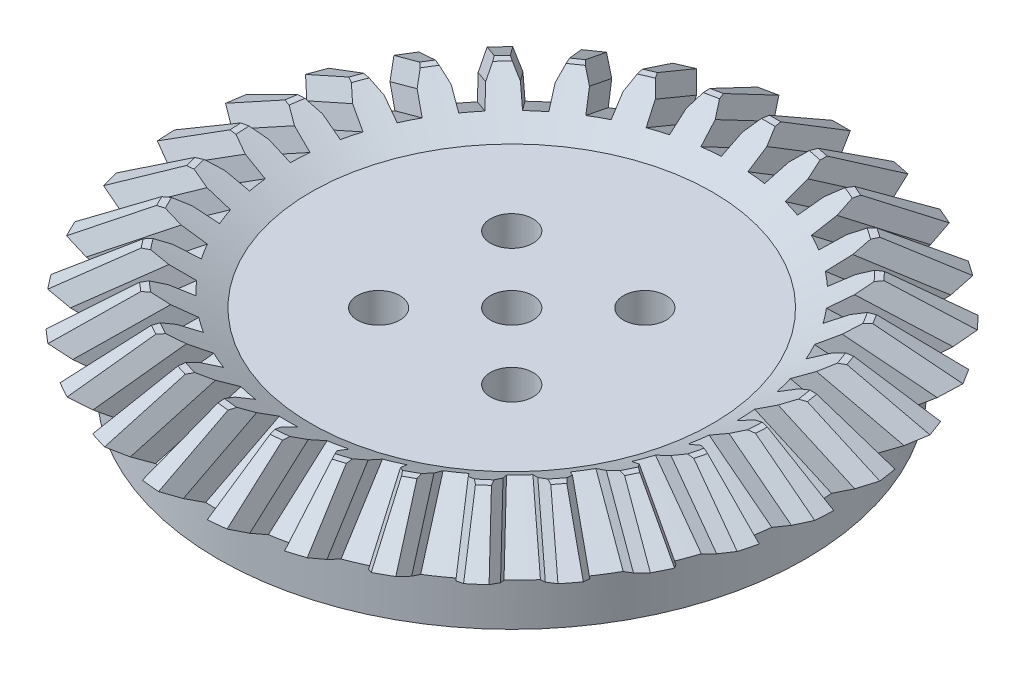
from build123d import *

# Parameters (mm, degrees)
SKETCH12_R          = 22.040007187
BOSS_EXTRUDE1_DEPTH = 3.2
SKETCH13_R          = 1.6
CUT_EXTRUDE1_DEPTH  = 5.332488592
SKETCH13_3_R        = 15.331067812
SKETCH13_3_R_2      = 11.331067812
CUT_EXTRUDE2_DEPTH  = 3


with BuildPart() as part:
    # Sketch1 → Loft2 section 0
    with BuildSketch(Plane(origin=(0, 0, 0), x_dir=(1, 0, 0), z_dir=(0, 1, 0))):
        with BuildLine():
            Line((-1.265, 22.003674507), (-1.265, 24.943674507))
            Line((-1.265, 24.943674507), (-0.817129469, 27.483674507))
            Line((-0.817129469, 27.483674507), (0.817129469, 27.483674507))
            Line((0.817129469, 27.483674507), (1.265, 24.943674507))
            Line((1.265, 24.943674507), (1.265, 22.003674507))
            ThreePointArc((1.265, 22.003674507), (2.229750544, 21.926927038), (3.190201739, 21.807900625))
            Line((3.190201739, 21.807900625), (3.782019388, 24.687718653))
            Line((3.782019388, 24.687718653), (4.732020224, 27.085569028))
            Line((4.732020224, 27.085569028), (6.332825786, 26.756595123))
            Line((6.332825786, 26.756595123), (6.26023014, 24.178433397))
            Line((6.26023014, 24.178433397), (5.66841249, 21.298615369))
            ThreePointArc((5.66841249, 21.298615369), (6.597965382, 21.029236069), (7.514796244, 20.719308729))
            Line((7.514796244, 20.719308729), (8.674202458, 23.421044696))
            Line((8.674202458, 23.421044696), (10.087440453, 25.578577171))
            Line((10.087440453, 25.578577171), (11.589255471, 24.93409759))
            Line((11.589255471, 24.93409759), (10.999165722, 22.423324382))
            Line((10.999165722, 22.423324382), (9.839759508, 19.721588416))
            ThreePointArc((9.839759508, 19.721588416), (10.696058742, 19.270605704), (11.531734108, 18.7824659))
            Line((11.531734108, 18.7824659), (13.21126266, 21.195510417))
            Line((13.21126266, 21.195510417), (15.029879685, 23.024395359))
            Line((15.029879685, 23.024395359), (16.371219675, 22.090795172))
            Line((16.371219675, 22.090795172), (15.287794167, 19.750201833))
            Line((15.287794167, 19.750201833), (13.608265614, 17.337157316))
            ThreePointArc((13.608265614, 17.337157316), (14.356254201, 16.723034478), (15.076561423, 16.076666709))
            Line((15.076561423, 16.076666709), (17.207452217, 18.102229451))
            Line((17.207452217, 18.102229451), (19.356993877, 19.527592095))
            Line((19.356993877, 19.527592095), (20.482944222, 18.343093005))
            Line((20.482944222, 18.343093005), (18.950538522, 16.2685037))
            Line((18.950538522, 16.2685037), (16.819647728, 14.242940958))
            ThreePointArc((16.819647728, 14.242940958), (17.428702926, 13.490820255), (18.004152541, 12.712686895))
            Line((18.004152541, 12.712686895), (20.499166658, 14.267841085))
            Line((20.499166658, 14.267841085), (22.891630464, 15.231326917))
            Line((22.891630464, 15.231326917), (23.756094626, 13.844422454))
            Line((23.756094626, 13.844422454), (21.837445604, 12.120771114))
            Line((21.837445604, 12.120771114), (19.342431487, 10.565616924))
            ThreePointArc((19.342431487, 10.565616924), (19.787618505, 9.706290266), (20.194651539, 8.828248185))
            Line((20.194651539, 8.828248185), (22.951642808, 9.849325629))
            Line((22.951642808, 9.849325629), (25.489081011, 10.311489426))
            Line((25.489081011, 10.311489426), (26.056667725, 8.778959622))
            Line((26.056667725, 8.778959622), (23.830325098, 7.476812734))
            Line((23.830325098, 7.476812734), (21.073333829, 6.455735291))
            ThreePointArc((21.073333829, 6.455735291), (21.336426658, 5.524383613), (21.558379131, 4.582379958))
            Line((21.558379131, 4.582379958), (24.464476004, 5.027577624))
            Line((24.464476004, 5.027577624), (27.043005587, 4.969498345))
            Line((27.043005587, 4.969498345), (27.290477786, 3.354085151))
            Line((27.290477786, 3.354085151), (24.847588281, 2.526752763))
            Line((24.847588281, 2.526752763), (21.941491408, 2.081555097))
            ThreePointArc((21.941491408, 2.081555097), (22.011718996, 1.116308045), (22.039504147, 0.148908556))
            Line((22.039504147, 0.148908556), (24.975730678, 0))
            Line((24.975730678, 0), (27.489786336, -0.575944581))
            Line((27.489786336, -0.575944581), (27.40701248, -2.20810596))
            Line((27.40701248, -2.20810596), (24.847588281, -2.526752763))
            Line((24.847588281, -2.526752763), (21.91136175, -2.377844207))
            ThreePointArc((21.91136175, -2.377844207), (21.785848973, -3.337469305), (21.618329275, -4.290659179))
            Line((21.618329275, -4.290659179), (24.464476004, -5.027577624))
            Line((24.464476004, -5.027577624), (26.811132003, -6.097808269))
            Line((26.811132003, -6.097808269), (26.401500862, -7.679896953))
            Line((26.401500862, -7.679896953), (23.830325098, -7.476812734))
            Line((23.830325098, -7.476812734), (20.984178368, -6.73989429))
            ThreePointArc((20.984178368, -6.73989429), (20.668063732, -7.654610269), (20.312097461, -8.554566823))
            Line((20.312097461, -8.554566823), (22.951642808, -9.849325629))
            Line((22.951642808, -9.849325629), (25.034826776, -11.37002697))
            Line((25.034826776, -11.37002697), (24.315108697, -12.837272063))
            Line((24.315108697, -12.837272063), (21.837445604, -12.120771114))
            Line((21.837445604, -12.120771114), (19.197900258, -10.826012308))
            ThreePointArc((19.197900258, -10.826012308), (18.704125535, -11.658370589), (18.174285992, -12.468249497))
            Line((18.174285992, -12.468249497), (20.499166658, -14.267841085))
            Line((20.499166658, -14.267841085), (22.233592799, -16.17675543))
            Line((22.233592799, -16.17675543), (21.233253126, -17.469087746))
            Line((21.233253126, -17.469087746), (18.950538522, -16.2685037))
            Line((18.950538522, -16.2685037), (16.625657856, -14.468912111))
            ThreePointArc((16.625657856, -14.468912111), (15.97443824, -15.184835848), (15.292417118, -15.871480571))
            Line((15.292417118, -15.871480571), (17.207452217, -18.102229451))
            Line((17.207452217, -18.102229451), (18.52211292, -20.321205623))
            Line((18.52211292, -20.321205623), (17.282105676, -21.385716925))
            Line((17.282105676, -21.385716925), (15.287794167, -19.750201833))
            Line((15.287794167, -19.750201833), (13.372759068, -17.519452952))
            ThreePointArc((13.372759068, -17.519452952), (12.590755567, -18.089632143), (11.784474891, -18.624931365))
            Line((11.784474891, -18.624931365), (13.21126266, -21.195510417))
            Line((13.21126266, -21.195510417), (14.052335562, -23.63370327))
            Line((14.052335562, -23.63370327), (12.62342679, -24.42681234))
            Line((12.62342679, -24.42681234), (10.999165722, -22.423324382))
            Line((10.999165722, -22.423324382), (9.572377952, -19.852745331))
            ThreePointArc((9.572377952, -19.852745331), (8.691605881, -20.253836773), (7.794074877, -20.615875282))
            Line((7.794074877, -20.615875282), (8.674202458, -23.421044696))
            Line((8.674202458, -23.421044696), (9.007253935, -25.978634328))
            Line((9.007253935, -25.978634328), (7.447943327, -26.467871187))
            Line((7.447943327, -26.467871187), (6.26023014, -24.178433397))
            Line((6.26023014, -24.178433397), (5.380102558, -21.373263983))
            ThreePointArc((5.380102558, -21.373263983), (4.43662083, -21.588846945), (3.484584522, -21.762802842))
            Line((3.484584522, -21.762802842), (3.782019388, -24.687718653))
            Line((3.782019388, -24.687718653), (3.593414274, -27.259997044))
            Line((3.593414274, -27.259997044), (1.96754019, -27.425332278))
            Line((1.96754019, -27.425332278), (1.265, -24.943674507))
            Line((1.265, -24.943674507), (0.967565133, -22.018758696))
            ThreePointArc((0.967565133, -22.018758696), (0, -22.040007187), (-0.967565133, -22.018758696))
            Line((-0.967565133, -22.018758696), (-1.265, -24.943674507))
            Line((-1.265, -24.943674507), (-1.96754019, -27.425332278))
            Line((-1.96754019, -27.425332278), (-3.593414274, -27.259997044))
            Line((-3.593414274, -27.259997044), (-3.782019388, -24.687718653))
            Line((-3.782019388, -24.687718653), (-3.484584522, -21.762802842))
            ThreePointArc((-3.484584522, -21.762802842), (-4.43662083, -21.588846945), (-5.380102558, -21.373263983))
            Line((-5.380102558, -21.373263983), (-6.26023014, -24.178433397))
            Line((-6.26023014, -24.178433397), (-7.447943327, -26.467871187))
            Line((-7.447943327, -26.467871187), (-9.007253935, -25.978634328))
            Line((-9.007253935, -25.978634328), (-8.674202458, -23.421044696))
            Line((-8.674202458, -23.421044696), (-7.794074877, -20.615875282))
            ThreePointArc((-7.794074877, -20.615875282), (-8.691605881, -20.253836773), (-9.572377952, -19.852745331))
            Line((-9.572377952, -19.852745331), (-10.999165722, -22.423324382))
            Line((-10.999165722, -22.423324382), (-12.62342679, -24.42681234))
            Line((-12.62342679, -24.42681234), (-14.052335562, -23.63370327))
            Line((-14.052335562, -23.63370327), (-13.21126266, -21.195510417))
            Line((-13.21126266, -21.195510417), (-11.784474891, -18.624931365))
            ThreePointArc((-11.784474891, -18.624931365), (-12.590755567, -18.089632143), (-13.372759068, -17.519452952))
            Line((-13.372759068, -17.519452952), (-15.287794167, -19.750201833))
            Line((-15.287794167, -19.750201833), (-17.282105676, -21.385716925))
            Line((-17.282105676, -21.385716925), (-18.52211292, -20.321205623))
            Line((-18.52211292, -20.321205623), (-17.207452217, -18.102229451))
            Line((-17.207452217, -18.102229451), (-15.292417118, -15.871480571))
            ThreePointArc((-15.292417118, -15.871480571), (-15.97443824, -15.184835848), (-16.625657856, -14.468912111))
            Line((-16.625657856, -14.468912111), (-18.950538522, -16.2685037))
            Line((-18.950538522, -16.2685037), (-21.233253126, -17.469087746))
            Line((-21.233253126, -17.469087746), (-22.233592799, -16.17675543))
            Line((-22.233592799, -16.17675543), (-20.499166658, -14.267841085))
            Line((-20.499166658, -14.267841085), (-18.174285992, -12.468249497))
            ThreePointArc((-18.174285992, -12.468249497), (-18.704125535, -11.658370589), (-19.197900258, -10.826012308))
            Line((-19.197900258, -10.826012308), (-21.837445604, -12.120771114))
            Line((-21.837445604, -12.120771114), (-24.315108697, -12.837272063))
            Line((-24.315108697, -12.837272063), (-25.034826776, -11.37002697))
            Line((-25.034826776, -11.37002697), (-22.951642808, -9.849325629))
            Line((-22.951642808, -9.849325629), (-20.312097461, -8.554566823))
            ThreePointArc((-20.312097461, -8.554566823), (-20.668063732, -7.654610269), (-20.984178368, -6.73989429))
            Line((-20.984178368, -6.73989429), (-23.830325098, -7.476812734))
            Line((-23.830325098, -7.476812734), (-26.401500862, -7.679896953))
            Line((-26.401500862, -7.679896953), (-26.811132003, -6.097808269))
            Line((-26.811132003, -6.097808269), (-24.464476004, -5.027577624))
            Line((-24.464476004, -5.027577624), (-21.618329275, -4.290659179))
            ThreePointArc((-21.618329275, -4.290659179), (-21.785848973, -3.337469305), (-21.91136175, -2.377844207))
            Line((-21.91136175, -2.377844207), (-24.847588281, -2.526752763))
            Line((-24.847588281, -2.526752763), (-27.40701248, -2.20810596))
            Line((-27.40701248, -2.20810596), (-27.489786336, -0.575944581))
            Line((-27.489786336, -0.575944581), (-24.975730678, 0))
            Line((-24.975730678, 0), (-22.039504147, 0.148908556))
            ThreePointArc((-22.039504147, 0.148908556), (-22.011718996, 1.116308045), (-21.941491408, 2.081555097))
            Line((-21.941491408, 2.081555097), (-24.847588281, 2.526752763))
            Line((-24.847588281, 2.526752763), (-27.290477786, 3.354085151))
            Line((-27.290477786, 3.354085151), (-27.043005587, 4.969498345))
            Line((-27.043005587, 4.969498345), (-24.464476004, 5.027577624))
            Line((-24.464476004, 5.027577624), (-21.558379131, 4.582379958))
            ThreePointArc((-21.558379131, 4.582379958), (-21.336426658, 5.524383613), (-21.073333829, 6.455735291))
            Line((-21.073333829, 6.455735291), (-23.830325098, 7.476812734))
            Line((-23.830325098, 7.476812734), (-26.056667725, 8.778959622))
            Line((-26.056667725, 8.778959622), (-25.489081011, 10.311489426))
            Line((-25.489081011, 10.311489426), (-22.951642808, 9.849325629))
            Line((-22.951642808, 9.849325629), (-20.194651539, 8.828248185))
            ThreePointArc((-20.194651539, 8.828248185), (-19.787618505, 9.706290266), (-19.342431487, 10.565616924))
            Line((-19.342431487, 10.565616924), (-21.837445604, 12.120771114))
            Line((-21.837445604, 12.120771114), (-23.756094626, 13.844422454))
            Line((-23.756094626, 13.844422454), (-22.891630464, 15.231326917))
            Line((-22.891630464, 15.231326917), (-20.499166658, 14.267841085))
            Line((-20.499166658, 14.267841085), (-18.004152541, 12.712686895))
            ThreePointArc((-18.004152541, 12.712686895), (-17.428702926, 13.490820255), (-16.819647728, 14.242940958))
            Line((-16.819647728, 14.242940958), (-18.950538522, 16.2685037))
            Line((-18.950538522, 16.2685037), (-20.482944222, 18.343093005))
            Line((-20.482944222, 18.343093005), (-19.356993877, 19.527592095))
            Line((-19.356993877, 19.527592095), (-17.207452217, 18.102229451))
            Line((-17.207452217, 18.102229451), (-15.076561423, 16.076666709))
            ThreePointArc((-15.076561423, 16.076666709), (-14.356254201, 16.723034478), (-13.608265614, 17.337157316))
            Line((-13.608265614, 17.337157316), (-15.287794167, 19.750201833))
            Line((-15.287794167, 19.750201833), (-16.371219675, 22.090795172))
            Line((-16.371219675, 22.090795172), (-15.029879685, 23.024395359))
            Line((-15.029879685, 23.024395359), (-13.21126266, 21.195510417))
            Line((-13.21126266, 21.195510417), (-11.531734108, 18.7824659))
            ThreePointArc((-11.531734108, 18.7824659), (-10.696058742, 19.270605704), (-9.839759508, 19.721588416))
            Line((-9.839759508, 19.721588416), (-10.999165722, 22.423324382))
            Line((-10.999165722, 22.423324382), (-11.589255471, 24.93409759))
            Line((-11.589255471, 24.93409759), (-10.087440453, 25.578577171))
            Line((-10.087440453, 25.578577171), (-8.674202458, 23.421044696))
            Line((-8.674202458, 23.421044696), (-7.514796244, 20.719308729))
            ThreePointArc((-7.514796244, 20.719308729), (-6.597965382, 21.029236069), (-5.66841249, 21.298615369))
            Line((-5.66841249, 21.298615369), (-6.26023014, 24.178433397))
            Line((-6.26023014, 24.178433397), (-6.332825786, 26.756595123))
            Line((-6.332825786, 26.756595123), (-4.732020224, 27.085569028))
            Line((-4.732020224, 27.085569028), (-3.782019388, 24.687718653))
            Line((-3.782019388, 24.687718653), (-3.190201739, 21.807900625))
            ThreePointArc((-3.190201739, 21.807900625), (-2.229750544, 21.926927038), (-1.265, 22.003674507))
        make_face()
    # Sketch10 → Loft2 section 1
    with BuildSketch(Plane(origin=(0, 8, -4), x_dir=(1, 0, 0), z_dir=(0, -1, 0))):
        with BuildLine():
            Line((-1.436613548, 12.394354401), (-1.734048415, 15.319270212))
            Line((-1.734048415, 15.319270212), (-1.545443301, 17.891548604))
            Line((-1.545443301, 17.891548604), (-1.28254019, 17.918283237))
            Line((-1.28254019, 17.918283237), (-0.58, 15.436625466))
            Line((-0.58, 15.436625466), (-0.282565133, 12.511709655))
            ThreePointArc((-0.282565133, 12.511709655), (0, 12.516398552), (0.282565133, 12.511709655))
            Line((0.282565133, 12.511709655), (0.58, 15.436625466))
            Line((0.58, 15.436625466), (1.28254019, 17.918283237))
            Line((1.28254019, 17.918283237), (1.545443301, 17.891548604))
            Line((1.545443301, 17.891548604), (1.734048415, 15.319270212))
            Line((1.734048415, 15.319270212), (1.436613548, 12.394354401))
            ThreePointArc((1.436613548, 12.394354401), (1.714338425, 12.342067374), (1.990175565, 12.280594515))
            Line((1.990175565, 12.280594515), (2.870303147, 15.085763929))
            Line((2.870303147, 15.085763929), (4.058016335, 17.375201719))
            Line((4.058016335, 17.375201719), (4.310156161, 17.296092338))
            Line((4.310156161, 17.296092338), (3.977104684, 14.738502706))
            Line((3.977104684, 14.738502706), (3.096977103, 11.933333292))
            ThreePointArc((3.096977103, 11.933333292), (3.358491634, 11.826210977), (3.616307976, 11.710470863))
            Line((3.616307976, 11.710470863), (5.043095746, 14.281049914))
            Line((5.043095746, 14.281049914), (6.667356814, 16.284537872))
            Line((6.667356814, 16.284537872), (6.898410722, 16.15629249))
            Line((6.898410722, 16.15629249), (6.057337821, 13.718099638))
            Line((6.057337821, 13.718099638), (4.630550051, 11.147520586))
            ThreePointArc((4.630550051, 11.147520586), (4.8651478, 10.989948583), (5.094388313, 10.824679628))
            Line((5.094388313, 10.824679628), (7.009423412, 13.055428508))
            Line((7.009423412, 13.055428508), (9.003734922, 14.6909436))
            Line((9.003734922, 14.6909436), (9.204243538, 14.5188126))
            Line((9.204243538, 14.5188126), (7.889582835, 12.299836428))
            Line((7.889582835, 12.299836428), (5.974547736, 10.069087548))
            ThreePointArc((5.974547736, 10.069087548), (6.172624244, 9.867516872), (6.363903794, 9.659485206))
            Line((6.363903794, 9.659485206), (8.688784461, 11.459076795))
            Line((8.688784461, 11.459076795), (10.971499064, 12.659660842))
            Line((10.971499064, 12.659660842), (11.133253541, 12.450691285))
            Line((11.133253541, 12.450691285), (9.398827401, 10.54177694))
            Line((9.398827401, 10.54177694), (7.073946734, 8.742185352))
            ThreePointArc((7.073946734, 8.742185352), (7.227392726, 8.504868332), (7.372880306, 8.262590796))
            Line((7.372880306, 8.262590796), (10.012425653, 9.557349602))
            Line((10.012425653, 9.557349602), (12.490088746, 10.273850551))
            Line((12.490088746, 10.273850551), (12.606466836, 10.036597677))
            Line((12.606466836, 10.036597677), (10.523282868, 8.515896336))
            Line((10.523282868, 8.515896336), (7.883737522, 7.22113753))
            ThreePointArc((7.883737522, 7.22113753), (7.986270901, 6.957789953), (8.080010232, 6.691185418))
            Line((8.080010232, 6.691185418), (10.926156962, 7.428103862))
            Line((10.926156962, 7.428103862), (13.497332726, 7.631188081))
            Line((13.497332726, 7.631188081), (13.563569898, 7.37536505))
            Line((13.563569898, 7.37536505), (11.216913899, 6.305134405))
            Line((11.216913899, 6.305134405), (8.37076717, 5.56821596))
            ThreePointArc((8.37076717, 5.56821596), (8.418190206, 5.289619305), (8.45634359, 5.009602592))
            Line((8.45634359, 5.009602592), (11.392570121, 5.158511148))
            Line((11.392570121, 5.158511148), (13.951994319, 4.839864345))
            Line((13.951994319, 4.839864345), (13.965378815, 4.575944581))
            Line((13.965378815, 4.575944581), (11.451323157, 4))
            Line((11.451323157, 4), (8.515096626, 3.851091444))
            ThreePointArc((8.515096626, 3.851091444), (8.505467816, 3.568651492), (8.486473248, 3.286686518))
            Line((8.486473248, 3.286686518), (11.392570121, 2.841488852))
            Line((11.392570121, 2.841488852), (13.835459626, 2.014156464))
            Line((13.835459626, 2.014156464), (13.795443482, 1.752944874))
            Line((13.795443482, 1.752944874), (11.216913899, 1.694865595))
            Line((11.216913899, 1.694865595), (8.310817026, 2.140063261))
            ThreePointArc((8.310817026, 2.140063261), (8.244530574, 1.865343137), (8.169165693, 1.592973581))
            Line((8.169165693, 1.592973581), (10.926156962, 0.571896138))
            Line((10.926156962, 0.571896138), (13.152499589, -0.73025075))
            Line((13.152499589, -0.73025075), (13.060721072, -0.978060133))
            Line((13.060721072, -0.978060133), (10.523282868, -0.515896336))
            Line((10.523282868, -0.515896336), (7.7662916, 0.505181108))
            ThreePointArc((7.7662916, 0.505181108), (7.646061281, 0.249427885), (7.517411536, -0.002195411))
            Line((7.517411536, -0.002195411), (10.012425653, -1.557349602))
            Line((10.012425653, -1.557349602), (11.931074674, -3.281000942))
            Line((11.931074674, -3.281000942), (11.791291207, -3.505262772))
            Line((11.791291207, -3.505262772), (9.398827401, -2.54177694))
            Line((9.398827401, -2.54177694), (6.903813284, -0.98662275))
            ThreePointArc((6.903813284, -0.98662275), (6.734561341, -1.212938504), (6.557893666, -1.433514053))
            Line((6.557893666, -1.433514053), (8.688784461, -3.459076795))
            Line((8.688784461, -3.459076795), (10.221190161, -5.5336661))
            Line((10.221190161, -5.5336661), (10.039124494, -5.725199072))
            Line((10.039124494, -5.725199072), (7.889582835, -4.299836428))
            Line((7.889582835, -4.299836428), (5.75869204, -2.274273686))
            ThreePointArc((5.75869204, -2.274273686), (5.547347669, -2.461886578), (5.32989486, -2.642383991))
            Line((5.32989486, -2.642383991), (7.009423412, -5.055428508))
            Line((7.009423412, -5.055428508), (8.092848921, -7.396021848))
            Line((8.092848921, -7.396021848), (7.875954845, -7.54698458))
            Line((7.875954845, -7.54698458), (6.057337821, -5.718099638))
            Line((6.057337821, -5.718099638), (4.377809268, -3.305055121))
            ThreePointArc((4.377809268, -3.305055121), (4.133024931, -3.446284256), (3.883689532, -3.579313948))
            Line((3.883689532, -3.579313948), (5.043095746, -6.281049914))
            Line((5.043095746, -6.281049914), (5.633185495, -8.791823122))
            Line((5.633185495, -8.791823122), (5.390342679, -8.896035182))
            Line((5.390342679, -8.896035182), (3.977104684, -6.738502706))
            Line((3.977104684, -6.738502706), (2.81769847, -4.03676674))
            ThreePointArc((2.81769847, -4.03676674), (2.549495667, -4.125830182), (2.278485498, -4.205945902))
            Line((2.278485498, -4.205945902), (2.870303147, -7.085763929))
            Line((2.870303147, -7.085763929), (2.942898793, -9.663925655))
            Line((2.942898793, -9.663925655), (2.684049251, -9.717120588))
            Line((2.684049251, -9.717120588), (1.734048415, -7.319270212))
            Line((1.734048415, -7.319270212), (1.142230766, -4.439452185))
            ThreePointArc((1.142230766, -4.439452185), (0.861589751, -4.472703666), (0.58, -4.496625466))
            Line((0.58, -4.496625466), (0.58, -7.436625466))
            Line((0.58, -7.436625466), (0.132129469, -9.976625466))
            Line((0.132129469, -9.976625466), (-0.132129469, -9.976625466))
            Line((-0.132129469, -9.976625466), (-0.58, -7.436625466))
            Line((-0.58, -7.436625466), (-0.58, -4.496625466))
            ThreePointArc((-0.58, -4.496625466), (-0.861589751, -4.472703666), (-1.142230766, -4.439452185))
            Line((-1.142230766, -4.439452185), (-1.734048415, -7.319270212))
            Line((-1.734048415, -7.319270212), (-2.684049251, -9.717120588))
            Line((-2.684049251, -9.717120588), (-2.942898793, -9.663925655))
            Line((-2.942898793, -9.663925655), (-2.870303147, -7.085763929))
            Line((-2.870303147, -7.085763929), (-2.278485498, -4.205945902))
            ThreePointArc((-2.278485498, -4.205945902), (-2.549495667, -4.125830182), (-2.81769847, -4.03676674))
            Line((-2.81769847, -4.03676674), (-3.977104684, -6.738502706))
            Line((-3.977104684, -6.738502706), (-5.390342679, -8.896035182))
            Line((-5.390342679, -8.896035182), (-5.633185495, -8.791823122))
            Line((-5.633185495, -8.791823122), (-5.043095746, -6.281049914))
            Line((-5.043095746, -6.281049914), (-3.883689532, -3.579313948))
            ThreePointArc((-3.883689532, -3.579313948), (-4.133024931, -3.446284256), (-4.377809268, -3.305055121))
            Line((-4.377809268, -3.305055121), (-6.057337821, -5.718099638))
            Line((-6.057337821, -5.718099638), (-7.875954845, -7.54698458))
            Line((-7.875954845, -7.54698458), (-8.092848921, -7.396021848))
            Line((-8.092848921, -7.396021848), (-7.009423412, -5.055428508))
            Line((-7.009423412, -5.055428508), (-5.32989486, -2.642383991))
            ThreePointArc((-5.32989486, -2.642383991), (-5.547347669, -2.461886578), (-5.75869204, -2.274273686))
            Line((-5.75869204, -2.274273686), (-7.889582835, -4.299836428))
            Line((-7.889582835, -4.299836428), (-10.039124494, -5.725199072))
            Line((-10.039124494, -5.725199072), (-10.221190161, -5.5336661))
            Line((-10.221190161, -5.5336661), (-8.688784461, -3.459076795))
            Line((-8.688784461, -3.459076795), (-6.557893666, -1.433514053))
            ThreePointArc((-6.557893666, -1.433514053), (-6.734561341, -1.212938504), (-6.903813284, -0.98662275))
            Line((-6.903813284, -0.98662275), (-9.398827401, -2.54177694))
            Line((-9.398827401, -2.54177694), (-11.791291207, -3.505262772))
            Line((-11.791291207, -3.505262772), (-11.931074674, -3.281000942))
            Line((-11.931074674, -3.281000942), (-10.012425653, -1.557349602))
            Line((-10.012425653, -1.557349602), (-7.517411536, -0.002195411))
            ThreePointArc((-7.517411536, -0.002195411), (-7.646061281, 0.249427885), (-7.7662916, 0.505181108))
            Line((-7.7662916, 0.505181108), (-10.523282868, -0.515896336))
            Line((-10.523282868, -0.515896336), (-13.060721072, -0.978060133))
            Line((-13.060721072, -0.978060133), (-13.152499589, -0.73025075))
            Line((-13.152499589, -0.73025075), (-10.926156962, 0.571896138))
            Line((-10.926156962, 0.571896138), (-8.169165693, 1.592973581))
            ThreePointArc((-8.169165693, 1.592973581), (-8.244530574, 1.865343137), (-8.310817026, 2.140063261))
            Line((-8.310817026, 2.140063261), (-11.216913899, 1.694865595))
            Line((-11.216913899, 1.694865595), (-13.795443482, 1.752944874))
            Line((-13.795443482, 1.752944874), (-13.835459626, 2.014156464))
            Line((-13.835459626, 2.014156464), (-11.392570121, 2.841488852))
            Line((-11.392570121, 2.841488852), (-8.486473248, 3.286686518))
            ThreePointArc((-8.486473248, 3.286686518), (-8.505467816, 3.568651492), (-8.515096626, 3.851091444))
            Line((-8.515096626, 3.851091444), (-11.451323157, 4))
            Line((-11.451323157, 4), (-13.965378815, 4.575944581))
            Line((-13.965378815, 4.575944581), (-13.951994319, 4.839864345))
            Line((-13.951994319, 4.839864345), (-11.392570121, 5.158511148))
            Line((-11.392570121, 5.158511148), (-8.45634359, 5.009602592))
            ThreePointArc((-8.45634359, 5.009602592), (-8.418190206, 5.289619305), (-8.37076717, 5.56821596))
            Line((-8.37076717, 5.56821596), (-11.216913899, 6.305134405))
            Line((-11.216913899, 6.305134405), (-13.563569898, 7.37536505))
            Line((-13.563569898, 7.37536505), (-13.497332726, 7.631188081))
            Line((-13.497332726, 7.631188081), (-10.926156962, 7.428103862))
            Line((-10.926156962, 7.428103862), (-8.080010232, 6.691185418))
            ThreePointArc((-8.080010232, 6.691185418), (-7.986270901, 6.957789953), (-7.883737522, 7.22113753))
            Line((-7.883737522, 7.22113753), (-10.523282868, 8.515896336))
            Line((-10.523282868, 8.515896336), (-12.606466836, 10.036597677))
            Line((-12.606466836, 10.036597677), (-12.490088746, 10.273850551))
            Line((-12.490088746, 10.273850551), (-10.012425653, 9.557349602))
            Line((-10.012425653, 9.557349602), (-7.372880306, 8.262590796))
            ThreePointArc((-7.372880306, 8.262590796), (-7.227392726, 8.504868332), (-7.073946734, 8.742185352))
            Line((-7.073946734, 8.742185352), (-9.398827401, 10.54177694))
            Line((-9.398827401, 10.54177694), (-11.133253541, 12.450691285))
            Line((-11.133253541, 12.450691285), (-10.971499064, 12.659660842))
            Line((-10.971499064, 12.659660842), (-8.688784461, 11.459076795))
            Line((-8.688784461, 11.459076795), (-6.363903794, 9.659485206))
            ThreePointArc((-6.363903794, 9.659485206), (-6.172624244, 9.867516872), (-5.974547736, 10.069087548))
            Line((-5.974547736, 10.069087548), (-7.889582835, 12.299836428))
            Line((-7.889582835, 12.299836428), (-9.204243538, 14.5188126))
            Line((-9.204243538, 14.5188126), (-9.003734922, 14.6909436))
            Line((-9.003734922, 14.6909436), (-7.009423412, 13.055428508))
            Line((-7.009423412, 13.055428508), (-5.094388313, 10.824679628))
            ThreePointArc((-5.094388313, 10.824679628), (-4.8651478, 10.989948583), (-4.630550051, 11.147520586))
            Line((-4.630550051, 11.147520586), (-6.057337821, 13.718099638))
            Line((-6.057337821, 13.718099638), (-6.898410722, 16.15629249))
            Line((-6.898410722, 16.15629249), (-6.667356814, 16.284537872))
            Line((-6.667356814, 16.284537872), (-5.043095746, 14.281049914))
            Line((-5.043095746, 14.281049914), (-3.616307976, 11.710470863))
            ThreePointArc((-3.616307976, 11.710470863), (-3.358491634, 11.826210977), (-3.096977103, 11.933333292))
            Line((-3.096977103, 11.933333292), (-3.977104684, 14.738502706))
            Line((-3.977104684, 14.738502706), (-4.310156161, 17.296092338))
            Line((-4.310156161, 17.296092338), (-4.058016335, 17.375201719))
            Line((-4.058016335, 17.375201719), (-2.870303147, 15.085763929))
            Line((-2.870303147, 15.085763929), (-1.990175565, 12.280594515))
            ThreePointArc((-1.990175565, 12.280594515), (-1.714338425, 12.342067374), (-1.436613548, 12.394354401))
        make_face()
    loft()

    # Sketch11 → Cut-Revolve1 (revolve, cut)
    with BuildSketch(Plane.XY, mode=Mode.PRIVATE) as cut_revolve1_sk:
        Polygon((0, 8), (0, 2.132488592), (15.075414277, 2.132488592), (19.27496668, 4.557101302), (19.579169442, 4.732732849), (25.23824215, 8), align=None)
        Polygon((19.579169442, 4.732732849), (19.27496668, 4.557101302), (19.87496668, 4.557101302), align=None)
        Polygon((24.798472731, 1.633737337), (22.046945462, 0), (27.55, 0), align=None)
    revolve(cut_revolve1_sk.sketch.rotate(Axis((0, 0, 0), (0, 1, 0)), 272.394633851), axis=Axis((0, 0, 0), (0, 1, 0)), mode=Mode.SUBTRACT)

    # Sketch12 → Boss-Extrude1 (add)
    with BuildSketch(Plane.XZ):
        with Locations(Location((0, 0, 0), (0, 0, 90))):
            Circle(SKETCH12_R)
    extrude(amount=BOSS_EXTRUDE1_DEPTH)

    # Sketch13 → Cut-Extrude1 (cut)
    with BuildSketch(Plane.XZ.offset(3.2)):
        with Locations(Location((-5, 5, 0), (0, 0, 270))):
            Circle(SKETCH13_R)
        with Locations(Location((5, 5, 0), (0, 0, 270))):
            Circle(SKETCH13_R)
        with Locations(Location((5, -5, 0), (0, 0, 270))):
            Circle(SKETCH13_R)
        with Locations(Location((-5, -5, 0), (0, 0, 270))):
            Circle(SKETCH13_R)
        with Locations(Location((0, 0, 0), (0, 0, 270))):
            Circle(SKETCH13_R)
    extrude(amount=-CUT_EXTRUDE1_DEPTH, mode=Mode.SUBTRACT)

    # Sketch13<3> → Cut-Extrude2 (cut)
    with BuildSketch(Plane.XZ.offset(3.2)):
        with Locations(Location((0, 0, 0), (0, 0, 270))):
            Circle(SKETCH13_3_R)
        with Locations(Location((0, 0, 0), (0, 0, 270))):
            Circle(SKETCH13_3_R_2, mode=Mode.SUBTRACT)
    extrude(amount=-CUT_EXTRUDE2_DEPTH, mode=Mode.SUBTRACT)


solid = part.part
